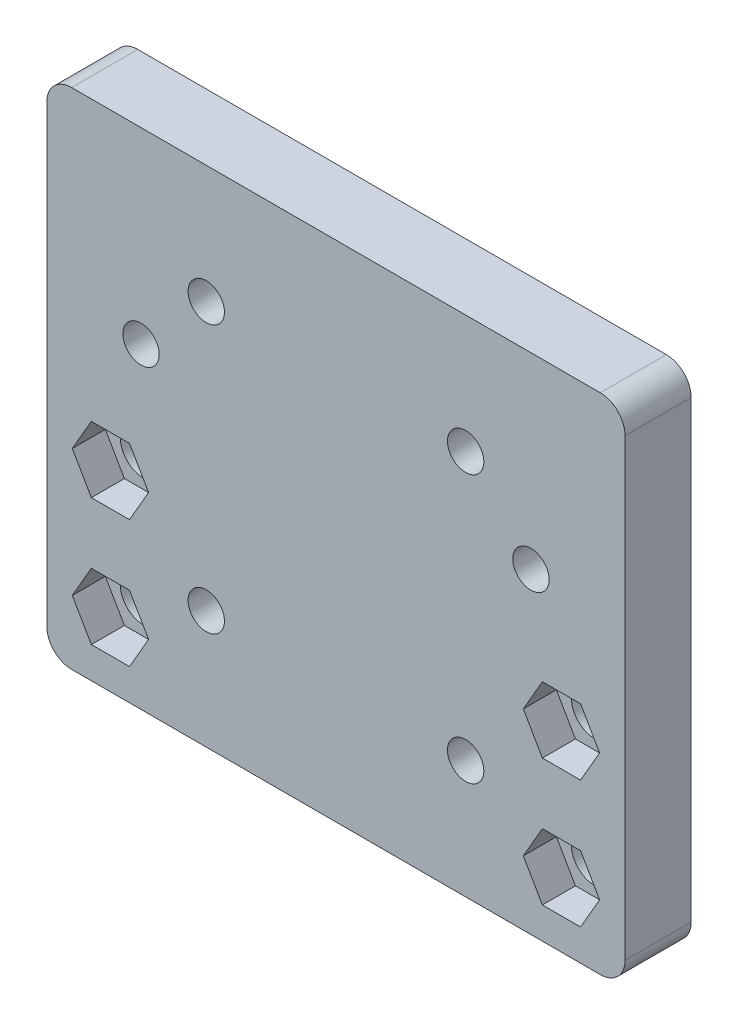
from build123d import *

# Parameters (mm, degrees)
SKETCH1_R           = 3.556
SKETCH1_R_2         = 2.794
BOSS_EXTRUDE1_DEPTH = 10.16
SKETCH2_R           = 5.334
CUT_EXTRUDE1_DEPTH  = 3.81
CUT_EXTRUDE2_DEPTH  = 5.08
CHAMFER1_SIZE       = 3.81


with BuildPart() as part:
    # Sketch1 → Boss-Extrude1 (new body)
    with BuildSketch(Plane.XY):
        with BuildLine():
            Line((40.64, -38.735), (-40.64, -38.735))
            ThreePointArc((-40.64, -38.735), (-43.334076836, -37.619076836), (-44.45, -34.925))
            Line((-44.45, -34.925), (-44.45, 34.925))
            ThreePointArc((-44.45, 34.925), (-43.334076836, 37.619076836), (-40.64, 38.735))
            Line((-40.64, 38.735), (40.64, 38.735))
            ThreePointArc((40.64, 38.735), (43.334076836, 37.619076836), (44.45, 34.925))
            Line((44.45, 34.925), (44.45, -34.925))
            ThreePointArc((44.45, -34.925), (43.334076836, -37.619076836), (40.64, -38.735))
        make_face()
        with Locations((-34.671, -9.271)):
            Circle(SKETCH1_R, mode=Mode.SUBTRACT)
        with Locations((-34.671, -28.829)):
            Circle(SKETCH1_R, mode=Mode.SUBTRACT)
        with Locations((34.671, -9.271)):
            Circle(SKETCH1_R, mode=Mode.SUBTRACT)
        with Locations((34.671, -28.829)):
            Circle(SKETCH1_R, mode=Mode.SUBTRACT)
        with Locations((-19.939, 20.574)):
            Circle(SKETCH1_R_2, mode=Mode.SUBTRACT)
        with Locations(Location((19.939, 20.574, 0), (0, 0, 180))):
            Circle(SKETCH1_R_2, mode=Mode.SUBTRACT)
        with Locations((19.939, -20.574)):
            Circle(SKETCH1_R_2, mode=Mode.SUBTRACT)
        with Locations(Location((-19.939, -20.574, 0), (0, 0, 180))):
            Circle(SKETCH1_R_2, mode=Mode.SUBTRACT)
        with Locations((29.972, 9.906)):
            Circle(SKETCH1_R_2, mode=Mode.SUBTRACT)
        with Locations((-29.972, 9.906)):
            Circle(SKETCH1_R_2, mode=Mode.SUBTRACT)
    extrude(amount=BOSS_EXTRUDE1_DEPTH)

    # Sketch2 → Cut-Extrude1 (cut)
    with BuildSketch(Plane(origin=(0, 0, 0), x_dir=(-1, 0, 0), z_dir=(0, 0, -1))):
        with Locations((-19.939, 20.574)):
            Circle(SKETCH2_R)
        with Locations((19.939, -20.574)):
            Circle(SKETCH2_R)
        with Locations((-19.939, -20.574)):
            Circle(SKETCH2_R)
        with Locations((19.939, 20.574)):
            Circle(SKETCH2_R)
        with Locations((-29.972, 9.906)):
            Circle(SKETCH2_R)
        with Locations((29.972, 9.906)):
            Circle(SKETCH2_R)
    extrude(amount=-CUT_EXTRUDE1_DEPTH, mode=Mode.SUBTRACT)

    # Sketch3 → Cut-Extrude2 (cut)
    with BuildSketch(Plane.XY.offset(10.16)):
        Polygon((-31.738060633, -14.351), (-28.805121265, -9.271), (-31.738060633, -4.191), (-37.603939367, -4.191), (-40.536878735, -9.271), (-37.603939367, -14.351), align=None)
        Polygon((-31.738060633, -33.909), (-28.805121265, -28.829), (-31.738060633, -23.749), (-37.603939367, -23.749), (-40.536878735, -28.829), (-37.603939367, -33.909), align=None)
        Polygon((37.603939367, -33.909), (31.738060633, -33.909), (28.805121265, -28.829), (31.738060633, -23.749), (37.603939367, -23.749), (40.536878735, -28.829), align=None)
        Polygon((37.603939367, -14.351), (31.738060633, -14.351), (28.805121265, -9.271), (31.738060633, -4.191), (37.603939367, -4.191), (40.536878735, -9.271), align=None)
    extrude(amount=-CUT_EXTRUDE2_DEPTH, mode=Mode.SUBTRACT)

    # Chamfer1
    # the kernel refuses this chamfer: 3.81 mm, written as the material it takes off along each edge
    with BuildSketch(Plane(origin=(19.939, 20.574, 0), x_dir=(-1, 0, 0), z_dir=(0, -1, 0))) as chamfer1_piece_1_section:
        Polygon((5.334 + CHAMFER1_SIZE, 0), (5.334, -CHAMFER1_SIZE), (5.334, 0), align=None)
    chamfer1_piece_1 = revolve(axis=Axis((19.939, 20.574, 0), (0, 0, -1)), mode=Mode.PRIVATE)
    chamfer1_piece_1 = split(chamfer1_piece_1, bisect_by=Plane(origin=(27.18300283, 20.574, 3.81), z_dir=(0, 0, -1)), keep=Keep.TOP, mode=Mode.PRIVATE)
    add(chamfer1_piece_1, mode=Mode.SUBTRACT)
    with BuildSketch(Plane(origin=(-19.939, 20.574, 0), x_dir=(-1, 0, 0), z_dir=(0, -1, 0))) as chamfer1_piece_2_section:
        Polygon((5.334 + CHAMFER1_SIZE, 0), (5.334, -CHAMFER1_SIZE), (5.334, 0), align=None)
    chamfer1_piece_2 = revolve(axis=Axis((-19.939, 20.574, 0), (0, 0, -1)), mode=Mode.PRIVATE)
    chamfer1_piece_2 = split(chamfer1_piece_2, bisect_by=Plane(origin=(-12.694997174, 20.574, 3.81), z_dir=(0, 0, -1)), keep=Keep.TOP, mode=Mode.PRIVATE)
    add(chamfer1_piece_2, mode=Mode.SUBTRACT)
    with BuildSketch(Plane(origin=(-19.939, -20.574, 0), x_dir=(-1, 0, 0), z_dir=(0, -1, 0))) as chamfer1_piece_3_section:
        Polygon((5.334 + CHAMFER1_SIZE, 0), (5.334, -CHAMFER1_SIZE), (5.334, 0), align=None)
    chamfer1_piece_3 = revolve(axis=Axis((-19.939, -20.574, 0), (0, 0, -1)), mode=Mode.PRIVATE)
    chamfer1_piece_3 = split(chamfer1_piece_3, bisect_by=Plane(origin=(-12.694997169, -20.574, 3.81), z_dir=(0, 0, -1)), keep=Keep.TOP, mode=Mode.PRIVATE)
    add(chamfer1_piece_3, mode=Mode.SUBTRACT)
    with BuildSketch(Plane(origin=(19.939, -20.574, 0), x_dir=(-1, 0, 0), z_dir=(0, -1, 0))) as chamfer1_piece_4_section:
        Polygon((5.334 + CHAMFER1_SIZE, 0), (5.334, -CHAMFER1_SIZE), (5.334, 0), align=None)
    chamfer1_piece_4 = revolve(axis=Axis((19.939, -20.574, 0), (0, 0, -1)), mode=Mode.PRIVATE)
    chamfer1_piece_4 = split(chamfer1_piece_4, bisect_by=Plane(origin=(27.183002828, -20.574, 3.81), z_dir=(0, 0, -1)), keep=Keep.TOP, mode=Mode.PRIVATE)
    add(chamfer1_piece_4, mode=Mode.SUBTRACT)
    with BuildSketch(Plane(origin=(29.972, 9.906, 0), x_dir=(-1, 0, 0), z_dir=(0, -1, 0))) as chamfer1_piece_5_section:
        Polygon((5.334 + CHAMFER1_SIZE, 0), (5.334, -CHAMFER1_SIZE), (5.334, 0), align=None)
    chamfer1_piece_5 = revolve(axis=Axis((29.972, 9.906, 0), (0, 0, -1)), mode=Mode.PRIVATE)
    chamfer1_piece_5 = split(chamfer1_piece_5, bisect_by=Plane(origin=(37.216002826, 9.906, 3.81), z_dir=(0, 0, -1)), keep=Keep.TOP, mode=Mode.PRIVATE)
    add(chamfer1_piece_5, mode=Mode.SUBTRACT)
    with BuildSketch(Plane(origin=(-29.972, 9.906, 0), x_dir=(-1, 0, 0), z_dir=(0, -1, 0))) as chamfer1_piece_6_section:
        Polygon((5.334 + CHAMFER1_SIZE, 0), (5.334, -CHAMFER1_SIZE), (5.334, 0), align=None)
    chamfer1_piece_6 = revolve(axis=Axis((-29.972, 9.906, 0), (0, 0, -1)), mode=Mode.PRIVATE)
    chamfer1_piece_6 = split(chamfer1_piece_6, bisect_by=Plane(origin=(-22.727997169, 9.906, 3.81), z_dir=(0, 0, -1)), keep=Keep.TOP, mode=Mode.PRIVATE)
    add(chamfer1_piece_6, mode=Mode.SUBTRACT)


solid = part.part
